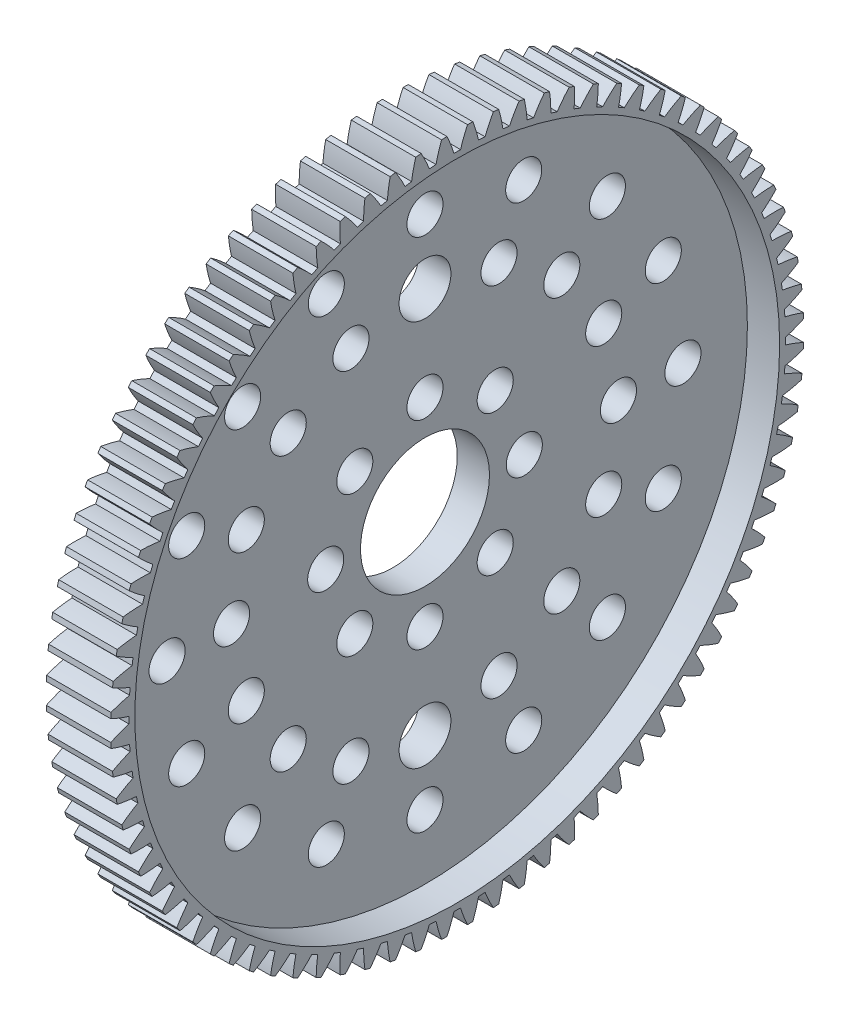
from build123d import *

# Parameters (mm, degrees)
BASPROSKE_W                 = 6.35
BASPROSKE_H                 = 34.13125
TOOTHCUT_DEPTH              = 49.684771265
TEETHCUTS_COUNT             = 84
TEETHCUTS_ANGLE             = 355.714285714
BORSKE_R                    = 6.35
BORE_DEPTH                  = 50.8000508
SKETCH1_R                   = 1.778
CUT_EXTRUDE1_DEPTH          = 49.663785458
SKETCH2_R                   = 31.75
CUT_EXTRUDE2_DEPTH          = 3.175
F_1_4_20_TAPPED_HOLE1_D     = 5.1054
F_1_4_20_TAPPED_HOLE1_DEPTH = 19.05
F_1_4_20_TAPPED_HOLE1_TIP   = 1.533816902


with BuildPart() as part:
    # BasProSke → Base-Revolve (revolve)
    with BuildSketch(Plane(origin=(0, 0, 0), x_dir=(1, 0, 0), z_dir=(0, 1, 0))):
        with Locations((3.175, 17.065625)):
            Rectangle(BASPROSKE_W, BASPROSKE_H)
    revolve(axis=Axis((-10, 0, 0), (1, 0, 0)))

    # TooCutSke → ToothCut (cut, through all)
    with BuildSketch(Plane(origin=(0, 0, 0), x_dir=(0, 0, -1), z_dir=(1, 0, 0))):
        with BuildLine():
            ThreePointArc((0.326676116, 32.332549735), (0, 32.3342), (-0.326676116, 32.332549735))
            ThreePointArc((-0.326676116, 32.332549735), (-0.641656256, 33.249603047), (-1.022442059, 34.141343727))
            ThreePointArc((-1.022442059, 34.141343727), (0, 34.15665), (1.022442059, 34.141343727))
            ThreePointArc((1.022442059, 34.141343727), (0.641656256, 33.249603047), (0.326676116, 32.332549735))
        make_face()
    toothcut = extrude(amount=TOOTHCUT_DEPTH, mode=Mode.SUBTRACT)

    # TeethCuts: ToothCut ×84 about axis
    teethcuts_axis = Axis((-10, 0, 0), (1, 0, 0))
    for i in range(1, TEETHCUTS_COUNT):
        add(toothcut.rotate(teethcuts_axis, i * TEETHCUTS_ANGLE / (TEETHCUTS_COUNT - 1)), mode=Mode.SUBTRACT)

    # BorSke → Bore (cut, symmetric)
    with BuildSketch(Plane(origin=(0, 0, 0), x_dir=(0, 0, -1), z_dir=(1, 0, 0))):
        Circle(BORSKE_R)
    extrude(amount=BORE_DEPTH, both=True, mode=Mode.SUBTRACT)

    # Sketch1 → Cut-Extrude1 (cut, through all)
    with BuildSketch(Plane(origin=(6.35, 0, 0), x_dir=(0, 0, -1), z_dir=(1, 0, 0))):
        with Locations((0, 9.779)):
            Circle(SKETCH1_R)
        with Locations((0, 19.05)):
            Circle(SKETCH1_R)
        with Locations((0, 25.4)):
            Circle(SKETCH1_R)
        with Locations((6.914797213, 6.914797213)):
            Circle(SKETCH1_R)
        with Locations((9.779, 0)):
            Circle(SKETCH1_R)
        with Locations((6.914797213, -6.914797213)):
            Circle(SKETCH1_R)
        with Locations((0, -9.779)):
            Circle(SKETCH1_R)
        with Locations((-6.914797213, -6.914797213)):
            Circle(SKETCH1_R)
        with Locations((-9.779, 0)):
            Circle(SKETCH1_R)
        with Locations((-6.914797213, 6.914797213)):
            Circle(SKETCH1_R)
        with Locations((7.290119387, 17.599905094)):
            Circle(SKETCH1_R)
        with Locations((9.720159182, 23.466540126)):
            Circle(SKETCH1_R)
        with Locations((13.470384182, 13.470384182)):
            Circle(SKETCH1_R)
        with Locations((17.960512242, 17.960512242)):
            Circle(SKETCH1_R)
        with Locations((17.599905094, 7.290119387)):
            Circle(SKETCH1_R)
        with Locations((23.466540126, 9.720159182)):
            Circle(SKETCH1_R)
        with Locations((19.05, 0)):
            Circle(SKETCH1_R)
        with Locations((25.4, 0)):
            Circle(SKETCH1_R)
        with Locations((17.599905094, -7.290119387)):
            Circle(SKETCH1_R)
        with Locations((23.466540126, -9.720159182)):
            Circle(SKETCH1_R)
        with Locations((13.470384182, -13.470384182)):
            Circle(SKETCH1_R)
        with Locations((17.960512242, -17.960512242)):
            Circle(SKETCH1_R)
        with Locations((7.290119387, -17.599905094)):
            Circle(SKETCH1_R)
        with Locations((9.720159182, -23.466540126)):
            Circle(SKETCH1_R)
        with Locations((0, -19.05)):
            Circle(SKETCH1_R)
        with Locations((0, -25.4)):
            Circle(SKETCH1_R)
        with Locations((-7.290119387, -17.599905094)):
            Circle(SKETCH1_R)
        with Locations((-9.720159182, -23.466540126)):
            Circle(SKETCH1_R)
        with Locations((-13.470384182, -13.470384182)):
            Circle(SKETCH1_R)
        with Locations((-17.960512242, -17.960512242)):
            Circle(SKETCH1_R)
        with Locations((-17.599905094, -7.290119387)):
            Circle(SKETCH1_R)
        with Locations((-23.466540126, -9.720159182)):
            Circle(SKETCH1_R)
        with Locations((-19.05, 0)):
            Circle(SKETCH1_R)
        with Locations((-25.4, 0)):
            Circle(SKETCH1_R)
        with Locations((-17.599905094, 7.290119387)):
            Circle(SKETCH1_R)
        with Locations((-23.466540126, 9.720159182)):
            Circle(SKETCH1_R)
        with Locations((-13.470384182, 13.470384182)):
            Circle(SKETCH1_R)
        with Locations((-17.960512242, 17.960512242)):
            Circle(SKETCH1_R)
        with Locations((-7.290119387, 17.599905094)):
            Circle(SKETCH1_R)
        with Locations((-9.720159182, 23.466540126)):
            Circle(SKETCH1_R)
    extrude(amount=-CUT_EXTRUDE1_DEPTH, mode=Mode.SUBTRACT)

    # Sketch2 → Cut-Extrude2 (cut)
    with BuildSketch(Plane(origin=(6.35, 0, 0), x_dir=(0, 0, -1), z_dir=(1, 0, 0))):
        Circle(SKETCH2_R)
    extrude(amount=-CUT_EXTRUDE2_DEPTH, mode=Mode.SUBTRACT)

    # 1/4-20 Tapped Hole1
    with Locations(Plane(origin=(3.175, 19.05, 0), x_dir=(0, 0, 1), z_dir=(1, 0, 0))):
        with Locations((0, 0), (0, 38.1)):
            Hole(F_1_4_20_TAPPED_HOLE1_D / 2, depth=F_1_4_20_TAPPED_HOLE1_DEPTH)
            with Locations((0, 0, -(F_1_4_20_TAPPED_HOLE1_DEPTH + F_1_4_20_TAPPED_HOLE1_TIP / 2))):  # 118° drill point
                Cone(0, F_1_4_20_TAPPED_HOLE1_D / 2, F_1_4_20_TAPPED_HOLE1_TIP, mode=Mode.SUBTRACT)


solid = part.part
